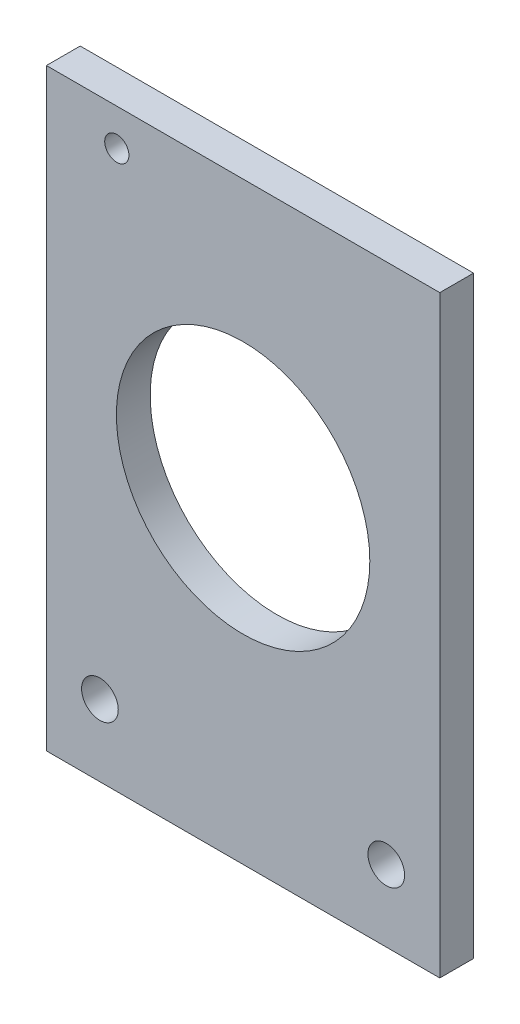
from build123d import *

# Parameters (mm, degrees)
SKETCH2_R           = 22.5
BOSS_EXTRUDE1_DEPTH = 3
SKETCH3_R           = 3.25755
SKETCH3_R_2         = 2.15
CUT_EXTRUDE1_DEPTH  = 6


with BuildPart() as part:
    # Sketch2 → Boss-Extrude1 (new, symmetric)
    with BuildSketch(Plane.XY):
        Polygon((-34.925, 0), (34.925, 0), (34.925, 57.9), (34.925, 90.4), (34.925, 105.4), (-34.925, 105.4), (-34.925, 90.4), (-34.925, 57.9), align=None)
        with Locations((0, 57.9)):
            Circle(SKETCH2_R, mode=Mode.SUBTRACT)
    extrude(amount=BOSS_EXTRUDE1_DEPTH, both=True)

    # Sketch3 → Cut-Extrude1 (cut)
    with BuildSketch(Plane.XY.offset(3)):
        with Locations((-25.425, 12.7)):
            Circle(SKETCH3_R)
        with Locations((25.425, 12.7)):
            Circle(SKETCH3_R)
        with Locations((-22.425, 98.9)):
            Circle(SKETCH3_R_2)
    extrude(amount=-CUT_EXTRUDE1_DEPTH, mode=Mode.SUBTRACT)


solid = part.part
